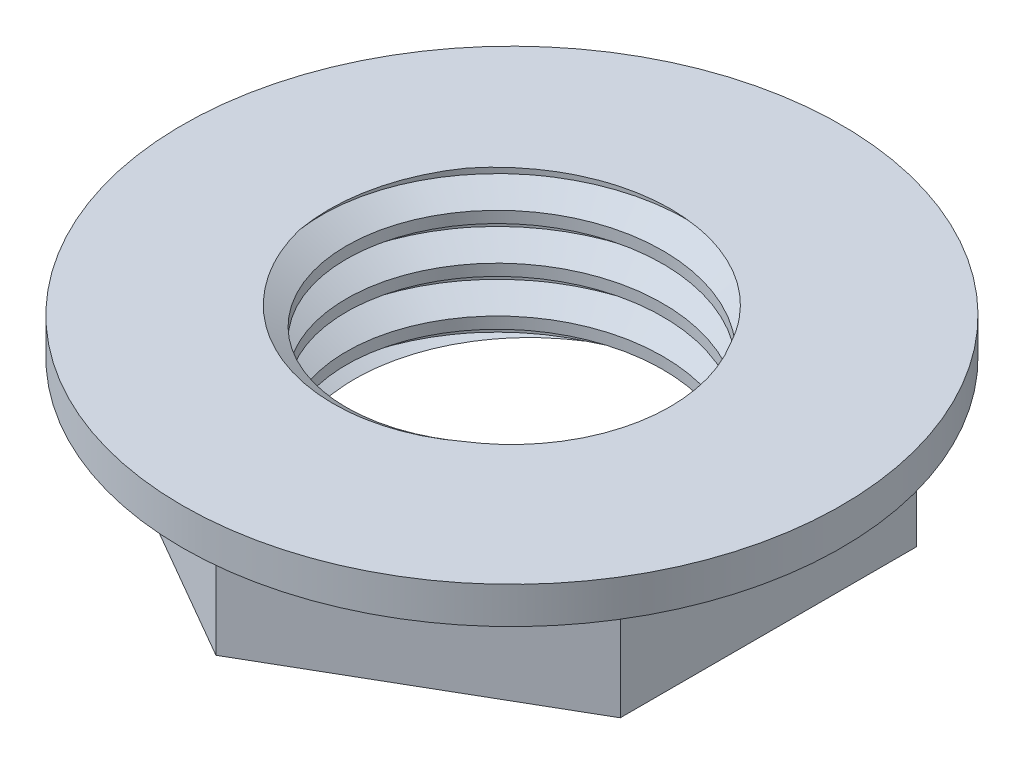
from build123d import *
from build123d.topology import SkipClean

# Parameters (mm, degrees)
SKETCH20_R          = 18
SKETCH20_R_2        = 10
BOSS_EXTRUDE5_DEPTH = 2
BOSS_EXTRUDE6_START = 6
SKETCH21_R          = 10
BOSS_EXTRUDE6_DEPTH = 6
THREAD1_PITCH       = 2.5
THREAD1_FROM        = 3
THREAD1_TO          = 11


with BuildPart() as part:
    # Sketch20 → Boss-Extrude5 (new body)
    with BuildSketch(Plane(origin=(0, 0, 0), x_dir=(-1, 0, 0), z_dir=(0, 1, 0))):
        with Locations(Location((0, 0, 0), (0, 0, 90))):
            Circle(SKETCH20_R)
        with Locations(Location((0, 0, 0), (0, 0, 90))):
            Circle(SKETCH20_R_2, mode=Mode.SUBTRACT)
    extrude(amount=BOSS_EXTRUDE5_DEPTH)

    # Sketch21 → Boss-Extrude6 (add)
    with SkipClean():  # the faces are left unmerged after this step: merging them gives an invalid solid
        with BuildSketch(Plane(origin=(0, 0, 0), x_dir=(-1, 0, 0), z_dir=(0, -1, 0)).offset(BOSS_EXTRUDE6_START)):
            Polygon((0, 16.165807537), (-14, 8.082903769), (-14, -8.082903769), (0, -16.165807537), (14, -8.082903769), (14, 8.082903769), align=None)
            with Locations(Location((0, 0, 0), (0, 0, 90))):
                Circle(SKETCH21_R, mode=Mode.SUBTRACT)
        extrude(amount=-BOSS_EXTRUDE6_DEPTH)

    # Thread1: arcs per turn and ends read off the stored shape
    # Thread1: the profile of Thread Profile1 profile screwed along a right-hand helix through 4.8 turns, 10 arcs to a turn; built about Z, then put on its axis
    thread1_z = Axis((0, 0, 0), (0, 0, 1))
    thread1_corners = [(10.0003, 4e-09, -0.000173205), (10.0003, 4e-09, 2.187673198), (8.646835313, 4e-09, 1.406249997), (8.646835313, 4e-09, 0.781249997)]
    with BuildLine(mode=Mode.PRIVATE) as thread1_profile:
        Line(thread1_corners[0], thread1_corners[1])
        Line(thread1_corners[1], thread1_corners[2])
        Line(thread1_corners[2], thread1_corners[3])
        Line(thread1_corners[3], thread1_corners[0])
    thread1_cap = Face(thread1_profile.wire())
    thread1_turn_angles = [0, 18, 36, 54, 72, 90, 108, 126, 144, 162, 180, 198, 216, 234, 252, 270, 288, 306, 324, 342, 360]
    thread1_turn_weights = [1, 0.9510565162951535, 1, 0.9510565162951535, 1, 0.9510565162951535, 1, 0.9510565162951535, 1, 0.9510565162951535, 1, 0.9510565162951535, 1, 0.9510565162951535, 1, 0.9510565162951535, 1, 0.9510565162951535, 1, 0.9510565162951535, 1]
    thread1_turn_rails = [Edge.make_bspline([Vector(p[0], p[1], 0).rotate(thread1_z, thread1_turn_angles[k]) / thread1_turn_weights[k] + Vector(0, 0, p[2] + THREAD1_PITCH * thread1_turn_angles[k] / 360) for k in range(21)], [0, 0, 0, 1, 1, 2, 2, 3, 3, 4, 4, 5, 5, 6, 6, 7, 7, 8, 8, 9, 9, 10, 10, 10], 2, thread1_turn_weights) for p in thread1_corners]
    thread1_turn_sides = [Face.make_surface_from_curves(thread1_turn_rails[p[0]], thread1_turn_rails[p[1]]) for p in [(0, 1), (1, 2), (2, 3), (3, 0)]]
    thread1_last_angles = [1440, 1458, 1476, 1494, 1512, 1530, 1548, 1566, 1584, 1602, 1620, 1638, 1656, 1674, 1692, 1710, 1728]
    thread1_last_weights = [1, 0.9510565162951535, 1, 0.9510565162951535, 1, 0.9510565162951535, 1, 0.9510565162951535, 1, 0.9510565162951535, 1, 0.9510565162951535, 1, 0.9510565162951535, 1, 0.9510565162951542, 1]
    thread1_last_rails = [Edge.make_bspline([Vector(p[0], p[1], 0).rotate(thread1_z, thread1_last_angles[k]) / thread1_last_weights[k] + Vector(0, 0, p[2] + THREAD1_PITCH * thread1_last_angles[k] / 360) for k in range(17)], [0, 0, 0, 1, 1, 2, 2, 3, 3, 4, 4, 5, 5, 6, 6, 7, 7, 8, 8, 8], 2, thread1_last_weights) for p in thread1_corners]
    thread1_last_sides = [Face.make_surface_from_curves(thread1_last_rails[p[0]], thread1_last_rails[p[1]]) for p in [(0, 1), (1, 2), (2, 3), (3, 0)]]
    thread1 = Plane(origin=(0, -9, 0), x_dir=(0.999847695, 0, -0.017452406), z_dir=(0, 1, 0)) * split(split(Solid(Shell([*[p.moved(Location((0, 0, THREAD1_PITCH * i))) for i in range(4) for p in thread1_turn_sides], *thread1_last_sides, thread1_cap, thread1_cap.rotate(thread1_z, 1728).moved(Location((0, 0, THREAD1_PITCH * 1728 / 360)))])), bisect_by=Plane.XY.offset(THREAD1_FROM), keep=Keep.TOP, mode=Mode.PRIVATE), bisect_by=Plane.XY.offset(THREAD1_TO), keep=Keep.BOTTOM, mode=Mode.PRIVATE)
    add(thread1)


solid = part.part
